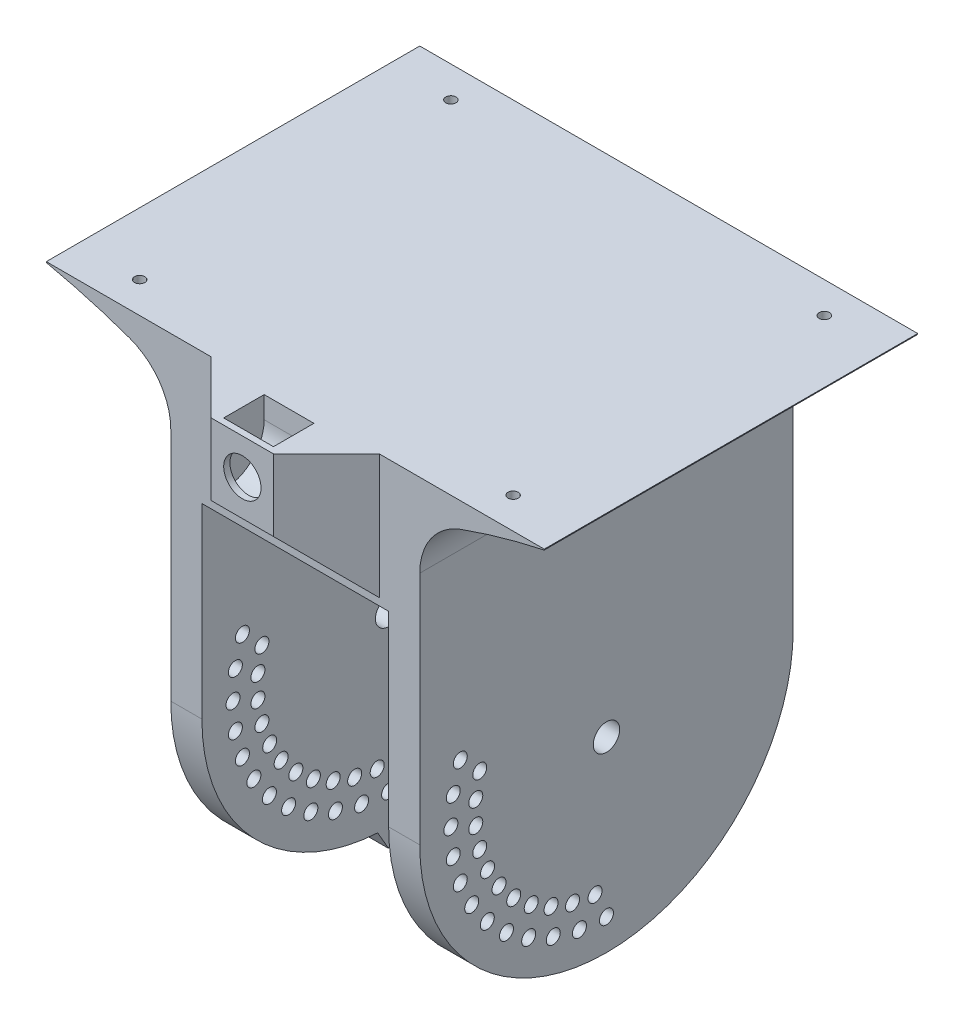
from build123d import *

# Parameters (mm, degrees)
BOSS_EXTRUDE1_DEPTH = 120
SKETCH2_W           = 80
SKETCH2_H           = 30
BOSS_EXTRUDE2_DEPTH = 120
FILLET1_R           = 20
SKETCH3_W           = 10
SKETCH3_H           = 120
BOSS_EXTRUDE3_DEPTH = 120
FILLET2_R           = 60
SKETCH4_R           = 4.25
SKETCH4_R_2         = 2.25
CUT_EXTRUDE1_DEPTH  = 406.975263542
SKETCH6_W           = 20
SKETCH6_H           = 17
SKETCH6_W_2         = 16
SKETCH6_H_2         = 13
BOSS_EXTRUDE4_DEPTH = 20
SKETCH7_W           = 20
SKETCH7_H           = 17
BOSS_EXTRUDE5_DEPTH = 3
FILLET3_R           = 13
SKETCH8_R           = 6
CUT_EXTRUDE2_DEPTH  = 3
CHAMFER1_SIZE       = 17
SKETCH10_R          = 1.65
CUT_EXTRUDE3_DEPTH  = 218.122958345
SKETCH11_R          = 3
CUT_EXTRUDE4_DEPTH  = 215.149368903
BOSS_EXTRUDE6_DEPTH = 10
CHAMFER3_SIZE       = 17


with BuildPart() as part:
    # Sketch1 → Boss-Extrude1 (new body)
    with BuildSketch(Plane.XY):
        with BuildLine():
            Line((80, -206.5), (-80, -206.5))
            Line((-80, -206.5), (-80, -206.771199773))
            ThreePointArc((-80, -206.771199773), (-65.350122978, -210.451524762), (-51.0095809, -215.196263078))
            ThreePointArc((-51.0095809, -215.196263078), (0, -224.378994833), (51.0095809, -215.196263078))
            ThreePointArc((51.0095809, -215.196263078), (65.350122978, -210.451524762), (80, -206.771199773))
            Line((80, -206.771199773), (80, -206.5))
        make_face()
    extrude(amount=-BOSS_EXTRUDE1_DEPTH)

    # Sketch2 → Boss-Extrude2 (add)
    with BuildSketch(Plane(origin=(0, 0, -120), x_dir=(-1, 0, 0), z_dir=(0, 0, -1))):
        with Locations((0, -233.803354766)):
            Rectangle(SKETCH2_W, SKETCH2_H)
    extrude(amount=-BOSS_EXTRUDE2_DEPTH)

    # Fillet1
    fillet1_edges = [part.edges().sort_by_distance(p)[0] for p in [
        (40, -218.803354766, -60),
        (-40, -218.803354766, -60),
    ]]
    fillet(fillet1_edges, radius=FILLET1_R)

    # Sketch3 → Boss-Extrude3 (add)
    with BuildSketch(Plane.XZ.offset(248.803354766)):
        with Locations((35, -60)):
            Rectangle(SKETCH3_W, SKETCH3_H)
        with Locations((-35, -60)):
            Rectangle(SKETCH3_W, SKETCH3_H)
    extrude(amount=BOSS_EXTRUDE3_DEPTH)

    # Fillet2
    fillet2_edges = [part.edges().sort_by_distance(p)[0] for p in [
        (35, -368.803354766, -120),
        (35, -368.803354766, 0),
        (-35, -368.803354766, 0),
        (-35, -368.803354766, -120),
    ]]
    fillet(fillet2_edges, radius=FILLET2_R - 0.0001)  # a hair under: the kernel refuses the full size

    # Sketch4 → Cut-Extrude1 (cut, through all)
    with BuildSketch(Plane.ZY.offset(40)):
        with Locations(Location((-60, -308.803354766, 0), (0, 0, 270))):
            Circle(SKETCH4_R)
        with Locations(Location((-60, -358.803354766, 0), (0, 0, 270))):
            Circle(SKETCH4_R_2)
        with Locations(Location((-51.317591117, -358.043742416, 0), (0, 0, 270))):
            Circle(SKETCH4_R_2)
        with Locations(Location((-42.898992834, -355.787985805, 0), (0, 0, 270))):
            Circle(SKETCH4_R_2)
        with Locations(Location((-35, -352.104624955, 0), (0, 0, 270))):
            Circle(SKETCH4_R_2)
        with Locations(Location((-27.860619516, -347.105576922, 0), (0, 0, 270))):
            Circle(SKETCH4_R_2)
        with Locations(Location((-21.697777844, -340.94273525, 0), (0, 0, 270))):
            Circle(SKETCH4_R_2)
        with Locations(Location((-16.698729811, -333.803354766, 0), (0, 0, 270))):
            Circle(SKETCH4_R_2)
        with Locations(Location((-13.015368961, -325.904361932, 0), (0, 0, 270))):
            Circle(SKETCH4_R_2)
        with Locations(Location((-10.759612349, -317.485763649, 0), (0, 0, 270))):
            Circle(SKETCH4_R_2)
        with Locations(Location((-10, -308.803354766, 0), (0, 0, 270))):
            Circle(SKETCH4_R_2)
        with Locations(Location((-10.759612349, -300.120945882, 0), (0, 0, 270))):
            Circle(SKETCH4_R_2)
        with Locations(Location((-13.015368961, -291.702347599, 0), (0, 0, 270))):
            Circle(SKETCH4_R_2)
        with Locations(Location((-56.325476132, -350.803354766, 0), (0, 0, 270))):
            Circle(SKETCH4_R_2)
        with Locations(Location((-49.088076944, -349.527206019, 0), (0, 0, 270))):
            Circle(SKETCH4_R_2)
        with Locations(Location((-42.182231017, -347.013683659, 0), (0, 0, 270))):
            Circle(SKETCH4_R_2)
        with Locations(Location((-35.817768983, -343.339159791, 0), (0, 0, 270))):
            Circle(SKETCH4_R_2)
        with Locations(Location((-30.188071803, -338.615282963, 0), (0, 0, 270))):
            Circle(SKETCH4_R_2)
        with Locations(Location((-25.464194975, -332.985585782, 0), (0, 0, 270))):
            Circle(SKETCH4_R_2)
        with Locations(Location((-21.789671107, -326.621123749, 0), (0, 0, 270))):
            Circle(SKETCH4_R_2)
        with Locations(Location((-19.276148747, -319.715277822, 0), (0, 0, 270))):
            Circle(SKETCH4_R_2)
        with Locations(Location((-18, -312.477878634, 0), (0, 0, 270))):
            Circle(SKETCH4_R_2)
        with Locations(Location((-18, -305.128830898, 0), (0, 0, 270))):
            Circle(SKETCH4_R_2)
        with Locations(Location((-19.276148747, -297.89143171, 0), (0, 0, 270))):
            Circle(SKETCH4_R_2)
    extrude(amount=-CUT_EXTRUDE1_DEPTH, mode=Mode.SUBTRACT)

    # Sketch6 → Boss-Extrude4 (add)
    with BuildSketch(Plane(origin=(0, -206.5, 0), x_dir=(1, 0, 0), z_dir=(0, 1, 0))):
        with Locations((0, -8.5)):
            Rectangle(SKETCH6_W, SKETCH6_H)
        with Locations((0, -8.5)):
            Rectangle(SKETCH6_W_2, SKETCH6_H_2, mode=Mode.SUBTRACT)
    extrude(amount=-BOSS_EXTRUDE4_DEPTH)

    # Sketch7 → Boss-Extrude5 (add)
    with BuildSketch(Plane.XZ.offset(226.5)):
        with Locations((0, 8.5)):
            Rectangle(SKETCH7_W, SKETCH7_H)
    extrude(amount=BOSS_EXTRUDE5_DEPTH)

    # Fillet3
    fillet3_edges = [part.edges().sort_by_distance(p)[0] for p in [
        (0, -226.5, 2),
    ]]
    fillet(fillet3_edges, radius=FILLET3_R - 0.0001)  # a hair under: the kernel refuses the full size

    # Sketch8 → Cut-Extrude2 (cut)
    with BuildSketch(Plane.XY.offset(17)):
        with Locations((0, -218)):
            Circle(SKETCH8_R)
    extrude(amount=-CUT_EXTRUDE2_DEPTH, mode=Mode.SUBTRACT)

    # Chamfer1
    chamfer1_edges = [part.edges().sort_by_distance(p)[0] for p in [
        (0, -229.5, 0),
    ]]
    chamfer(chamfer1_edges, length=CHAMFER1_SIZE - 0.0001)  # a hair under: the kernel refuses the full size

    # Sketch10 → Cut-Extrude3 (cut, through all)
    with BuildSketch(Plane(origin=(0, -206.5, 0), x_dir=(1, 0, 0), z_dir=(0, 1, 0))):
        with Locations(Location((-60, 110, 0), (0, 0, 270))):
            Circle(SKETCH10_R)
        with Locations(Location((-60, 10, 0), (0, 0, 270))):
            Circle(SKETCH10_R)
        with Locations(Location((60, 10, 0), (0, 0, 270))):
            Circle(SKETCH10_R)
        with Locations(Location((60, 110, 0), (0, 0, 270))):
            Circle(SKETCH10_R)
    extrude(amount=-CUT_EXTRUDE3_DEPTH, mode=Mode.SUBTRACT)

    # Sketch11 → Cut-Extrude4 (cut, through all)
    with BuildSketch(Plane(origin=(0, -210.5, 0), x_dir=(1, 0, 0), z_dir=(0, 1, 0))):
        with Locations(Location((-60, 110, 0), (0, 0, 270))):
            Circle(SKETCH11_R)
        with Locations(Location((-60, 10, 0), (0, 0, 270))):
            Circle(SKETCH11_R)
        with Locations(Location((60, 110, 0), (0, 0, 270))):
            Circle(SKETCH11_R)
        with Locations(Location((60, 10, 0), (0, 0, 270))):
            Circle(SKETCH11_R)
    extrude(amount=-CUT_EXTRUDE4_DEPTH, mode=Mode.SUBTRACT)

    # Sketch13 → Boss-Extrude6 (add)
    with BuildSketch(Plane.ZY.offset(40)):
        Polygon((-60, -374.803354766), (-63.515300685, -368.700288419), (-60, -366.67551297), (-56.484699315, -368.700288419), align=None)
    extrude(amount=-BOSS_EXTRUDE6_DEPTH)

    # Chamfer3
    chamfer3_edges = [part.edges().sort_by_distance(p)[0] for p in [
        (10, -226.49995, 0),
        (-10, -226.49995, 0),
    ]]
    chamfer(chamfer3_edges, length=CHAMFER3_SIZE - 0.0001)  # a hair under: the kernel refuses the full size


solid = part.part
